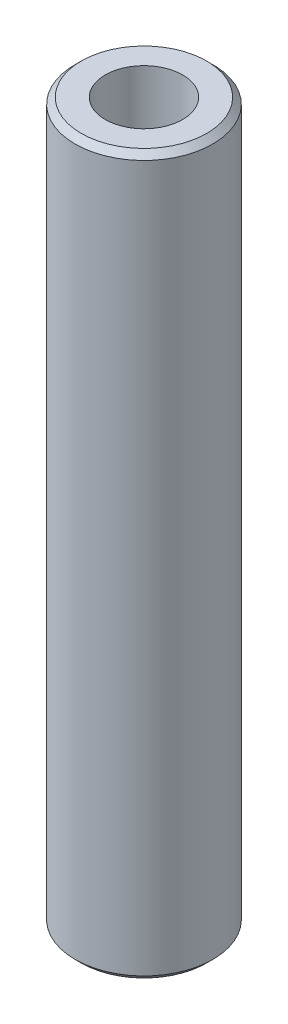
from build123d import *

# Parameters (mm, degrees)
SKETCH1_R           = 57.5
BOSS_EXTRUDE1_DEPTH = 600
SKETCH2_R           = 32.320542217
CUT_EXTRUDE1_DEPTH  = 606.485342515
CHAMFER1_SIZE       = 5.113599719


with BuildPart() as part:
    # Sketch1 → Boss-Extrude1 (new body)
    with BuildSketch(Plane(origin=(0, 0, 0), x_dir=(1, 0, 0), z_dir=(0, 1, 0))):
        Circle(SKETCH1_R)
    extrude(amount=BOSS_EXTRUDE1_DEPTH)

    # Sketch2 → Cut-Extrude1 (cut, through all)
    with BuildSketch(Plane(origin=(0, 0, 0), x_dir=(1, 0, 0), z_dir=(0, 1, 0))):
        Circle(SKETCH2_R)
    extrude(amount=CUT_EXTRUDE1_DEPTH, mode=Mode.SUBTRACT)

    # Chamfer1
    chamfer1_edges = [part.edges().sort_by_distance(p)[0] for p in [
        (-57.5, 600, 0),
        (-57.5, 0, 0),
    ]]
    chamfer(chamfer1_edges, length=CHAMFER1_SIZE)


solid = part.part
